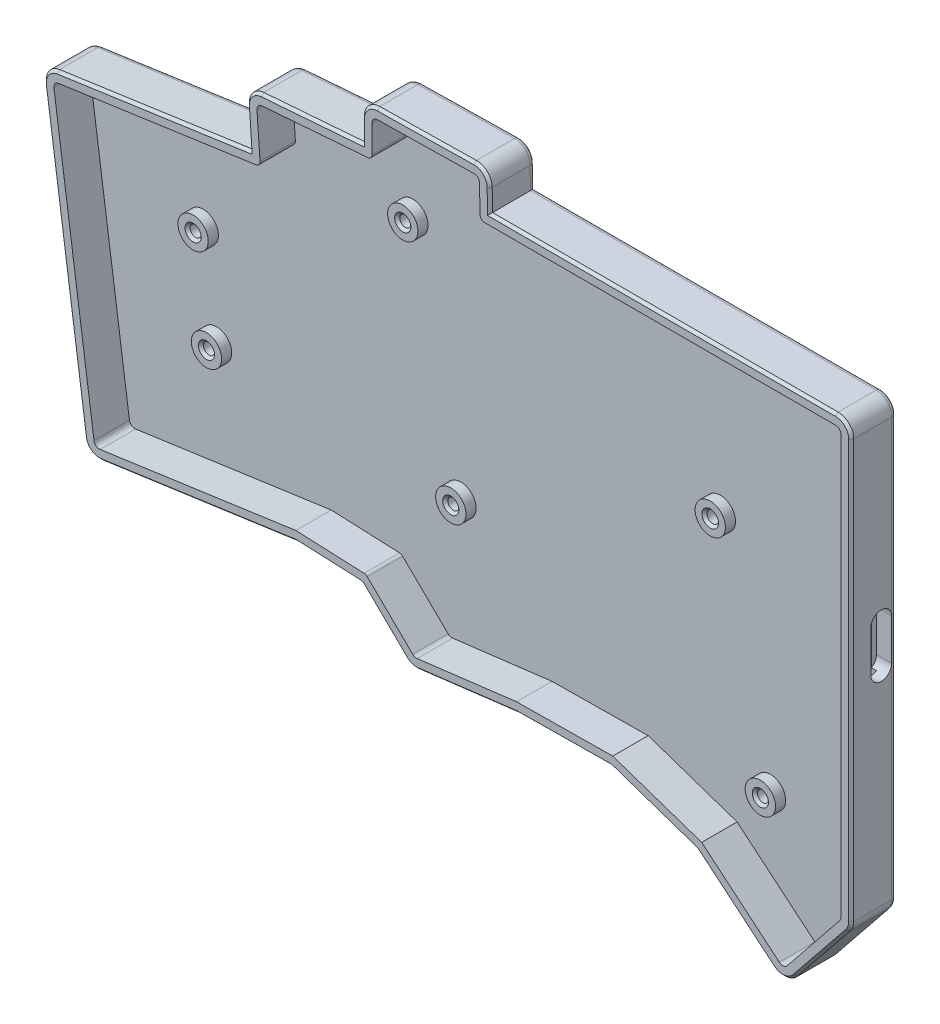
from build123d import *

# Parameters (mm, degrees)
BOSS_EXTRUDE1_DEPTH = 2
BOSS_EXTRUDE2_DEPTH = 9
SKETCH7_R           = 3
SKETCH7_R_2         = 1.100094
SKETCH7_R_3         = 1.100095
SKETCH7_R_4         = 1.14540164
SKETCH7_R_5         = 1.100094267
BOSS_EXTRUDE3_DEPTH = 4
CUT_EXTRUDE1_DEPTH  = 3
FILLET2_R           = 1
CHAMFER1_SIZE       = 0.5
CHAMFER2_SIZE       = 0.5


with BuildPart() as part:
    # Sketch3 → Boss-Extrude1 (new body)
    with BuildSketch(Plane.XY):
        with BuildLine():
            Line((60.855233133, 23.823211938), (47.949977192, 24.377676222))
            Line((47.949977192, 24.377676222), (9.438001399, 18.932389733))
            ThreePointArc((9.438001399, 18.932389733), (7.157815869, 19.520564151), (5.962231275, 21.549300871))
            Line((5.962231275, 21.549300871), (-1.970708405, 77.995680607))
            ThreePointArc((-1.970708405, 77.995680607), (-1.383464331, 80.271537635), (0.639738461, 81.467794829))
            Line((0.639738461, 81.467794829), (38.699898469, 86.902208152))
            Line((38.699898469, 86.902208152), (38.171393284, 94.460167157))
            ThreePointArc((38.171393284, 94.460167157), (38.910984807, 96.683773594), (41.002517903, 97.740613468))
            Line((41.002517903, 97.740613468), (60.921819416, 99.276682226))
            Line((60.921819416, 99.276682226), (60.921819416, 103.721902307))
            ThreePointArc((60.921819416, 103.721902307), (61.804499235, 105.878127499), (63.945786912, 106.796450874))
            Line((63.945786912, 106.796450874), (83.059551455, 107.113531682))
            ThreePointArc((83.059551455, 107.113531682), (85.251859467, 106.245869167), (86.185286941, 104.080744272))
            Line((86.185286941, 104.080744272), (86.24375422, 99.780452187))
            Line((86.24375422, 99.780452187), (154.596820419, 99.780452187))
            ThreePointArc((154.596820419, 99.780452187), (156.771169517, 98.879807301), (157.671814403, 96.705458202))
            Line((157.671814403, 96.705458202), (157.671814403, 14.057773112))
            ThreePointArc((157.671814403, 14.057773112), (157.497078938, 13.035997261), (156.992732263, 12.130352296))
            Line((156.992732263, 12.130352296), (146.547659954, -0.852593653))
            ThreePointArc((146.547659954, -0.852593653), (144.453525054, -1.98521487), (142.178510717, -1.283401812))
            Line((142.178510717, -1.283401812), (127.110775499, 11.324099062))
            Line((127.110775499, 11.324099062), (110.204782414, 17.079131321))
            Line((110.204782414, 17.079131321), (91.635796855, 16.870620568))
            Line((91.635796855, 16.870620568), (72.085555936, 14.46343429))
            ThreePointArc((72.085555936, 14.46343429), (70.725838171, 14.602041008), (69.560483965, 15.316179508))
            Line((69.560483965, 15.316179508), (60.855233133, 23.823211938))
        make_face()
    extrude(amount=BOSS_EXTRUDE1_DEPTH)

    # Sketch4 → Boss-Extrude2 (add)
    with BuildSketch(Plane.XY):
        with BuildLine():
            Line((47.949977192, 24.377676222), (60.855233133, 23.823211938))
            Line((60.855233133, 23.823211938), (69.560483965, 15.316179508))
            ThreePointArc((69.560483965, 15.316179508), (70.725838171, 14.602041008), (72.085555936, 14.46343429))
            Line((72.085555936, 14.46343429), (91.635796855, 16.870620568))
            Line((91.635796855, 16.870620568), (110.204782414, 17.079131321))
            Line((110.204782414, 17.079131321), (127.110775499, 11.324099062))
            Line((127.110775499, 11.324099062), (142.178510717, -1.283401812))
            ThreePointArc((142.178510717, -1.283401812), (144.453525054, -1.98521487), (146.547659954, -0.852593653))
            Line((146.547659954, -0.852593653), (156.992732263, 12.130352296))
            ThreePointArc((156.992732263, 12.130352296), (157.497078938, 13.035997261), (157.671814403, 14.057773112))
            Line((157.671814403, 14.057773112), (157.671814403, 96.705458202))
            ThreePointArc((157.671814403, 96.705458202), (156.771169517, 98.879807301), (154.596820419, 99.780452187))
            Line((154.596820419, 99.780452187), (86.24375422, 99.780452187))
            Line((86.24375422, 99.780452187), (86.185286941, 104.080744272))
            ThreePointArc((86.185286941, 104.080744272), (85.251859467, 106.245869167), (83.059551455, 107.113531682))
            Line((83.059551455, 107.113531682), (63.945786912, 106.796450874))
            ThreePointArc((63.945786912, 106.796450874), (61.804499235, 105.878127499), (60.921819416, 103.721902307))
            Line((60.921819416, 103.721902307), (60.921819416, 99.276682226))
            Line((60.921819416, 99.276682226), (41.002517903, 97.740613468))
            ThreePointArc((41.002517903, 97.740613468), (38.910984807, 96.683773594), (38.171393284, 94.460167157))
            Line((38.171393284, 94.460167157), (38.699898469, 86.902208152))
            Line((38.699898469, 86.902208152), (0.639738461, 81.467794829))
            ThreePointArc((0.639738461, 81.467794829), (-1.383464331, 80.271537635), (-1.970708405, 77.995680607))
            Line((-1.970708405, 77.995680607), (5.962231275, 21.549300871))
            ThreePointArc((5.962231275, 21.549300871), (7.157815869, 19.520564151), (9.438001399, 18.932389733))
            Line((9.438001399, 18.932389733), (47.949977192, 24.377676222))
        make_face()
        with BuildLine():
            ThreePointArc((84.258355662, 98.692914663), (84.533669024, 98.04695842), (85.183308419, 97.780452187))
            Line((85.183308419, 97.780452187), (154.596820419, 97.780452187))
            ThreePointArc((154.596820419, 97.780452187), (155.356955955, 97.465593738), (155.671814403, 96.705458202))
            Line((155.671814403, 96.705458202), (155.671814403, 14.057773112))
            ThreePointArc((155.671814403, 14.057773112), (155.610734868, 13.70060696), (155.434438315, 13.38403486))
            Line((155.434438315, 13.38403486), (144.989366006, 0.401088911))
            ThreePointArc((144.989366006, 0.401088911), (144.257272174, 0.005133041), (143.461944249, 0.250481615))
            Line((143.461944249, 0.250481615), (128.108249423, 13.097251096))
            Line((128.108249423, 13.097251096), (110.524936275, 19.082852408))
            Line((110.524936275, 19.082852408), (91.501949272, 18.869243682))
            Line((91.501949272, 18.869243682), (71.841145237, 16.448443965))
            ThreePointArc((71.841145237, 16.448443965), (71.365754809, 16.496904248), (70.958318613, 16.74658445))
            Line((70.958318613, 16.74658445), (61.958856362, 25.54112911))
            ThreePointArc((61.958856362, 25.54112911), (61.679828995, 25.728441638), (61.352295386, 25.803701118))
            Line((61.352295386, 25.803701118), (47.852081394, 26.383727313))
            Line((47.852081394, 26.383727313), (9.158002316, 20.91269287))
            ThreePointArc((9.158002316, 20.91269287), (8.360780393, 21.118336461), (7.942767807, 21.827644264))
            Line((7.942767807, 21.827644264), (0.009828128, 78.274024))
            ThreePointArc((0.009828128, 78.274024), (0.215128769, 79.069664055), (0.922440855, 79.487875801))
            Line((0.922440855, 79.487875801), (39.972806225, 85.063675424))
            ThreePointArc((39.972806225, 85.063675424), (40.561555536, 85.398058084), (40.76480024, 86.043913413))
            Line((40.76480024, 86.043913413), (40.166521363, 94.599680421))
            ThreePointArc((40.166521363, 94.599680421), (40.425084652, 95.377059525), (41.156290542, 95.746533736))
            Line((41.156290542, 95.746533736), (62.067941403, 97.359127107))
            ThreePointArc((62.067941403, 97.359127107), (62.675544492, 97.652931317), (62.921819416, 98.281303094))
            Line((62.921819416, 98.281303094), (62.921819416, 103.721902307))
            ThreePointArc((62.921819416, 103.721902307), (63.230393236, 104.475691655), (63.978960617, 104.796726017))
            Line((63.978960617, 104.796726017), (83.09272516, 105.113806824))
            ThreePointArc((83.09272516, 105.113806824), (83.859148665, 104.810474928), (84.185471769, 104.053554549))
            Line((84.185471769, 104.053554549), (84.258355662, 98.692914663))
        make_face(mode=Mode.SUBTRACT)
    extrude(amount=BOSS_EXTRUDE2_DEPTH)

    # Sketch7 → Boss-Extrude3 (add)
    # profile 1 of 6: a face of its own
    with BuildSketch(Plane.XY):
        with Locations((25.178343626, 43.435558637)):
            Circle(SKETCH7_R)
        with Locations((25.178343626, 43.435558637)):
            Circle(SKETCH7_R_2, mode=Mode.SUBTRACT)
    # profile 2 of 6: a face of its own
    with BuildSketch(Plane.XY):
        with Locations((22.534055897, 62.250653675)):
            Circle(SKETCH7_R)
        with Locations((22.534055897, 62.250653675)):
            Circle(SKETCH7_R_2, mode=Mode.SUBTRACT)
    # profile 3 of 6: a face of its own
    with BuildSketch(Plane.XY):
        with Locations((63.99681822, 84.705447078)):
            Circle(SKETCH7_R)
        with Locations((63.99681822, 84.705447078)):
            Circle(SKETCH7_R_3, mode=Mode.SUBTRACT)
    # profile 4 of 6: a face of its own
    with BuildSketch(Plane.XY):
        with Locations((73.496822591, 41.005447941)):
            Circle(SKETCH7_R)
        with Locations((73.496822591, 41.005447941)):
            Circle(SKETCH7_R_3, mode=Mode.SUBTRACT)
    # profile 5 of 6: a face of its own
    with BuildSketch(Plane.XY):
        with Locations((124.796820928, 64.405450202)):
            Circle(SKETCH7_R)
        with Locations((124.796820928, 64.405450202)):
            Circle(SKETCH7_R_4, mode=Mode.SUBTRACT)
    # profile 6 of 6: a face of its own
    with BuildSketch(Plane.XY):
        with Locations((134.70931431, 21.546419059)):
            Circle(SKETCH7_R)
        with Locations((134.70931431, 21.546419059)):
            Circle(SKETCH7_R_5, mode=Mode.SUBTRACT)
    extrude(amount=BOSS_EXTRUDE3_DEPTH)

    # Sketch8 → Cut-Extrude1 (cut)
    with BuildSketch(Plane(origin=(157.671814403, 0, 0), x_dir=(0, 0, -1), z_dir=(1, 0, 0))):
        with BuildLine():
            Line((-1, 62.669458202), (-1, 54.541458202))
            ThreePointArc((-1, 54.541458202), (-3.061576359, 52.479881843), (-5.123152718, 54.541458202))
            Line((-5.123152718, 54.541458202), (-5.123152718, 62.669458202))
            ThreePointArc((-5.123152718, 62.669458202), (-3.061576359, 64.731034561), (-1, 62.669458202))
        make_face()
    extrude(amount=-CUT_EXTRUDE1_DEPTH, mode=Mode.SUBTRACT)

    # Fillet2
    fillet2_edges = [part.edges().sort_by_distance(p)[0] for p in [
        (65.207858549, 19.569695723, 0),
        (54.402605163, 24.10044408, 0),
        (28.693989296, 21.655032978, 0),
        (7.157815869, 19.520564151, 0),
        (1.995761435, 49.772490739, 0),
        (-1.383464331, 80.271537635, 0),
        (19.669818465, 84.18500149, 0),
        (38.435645877, 90.681187654, 0),
        (38.910984807, 96.683773594, 0),
        (50.962168659, 98.508647847, 0),
        (60.921819416, 101.499292266, 0),
        (61.804499235, 105.878127499, 0),
        (73.502669184, 106.954991278, 0),
        (85.251859467, 106.245869167, 0),
        (86.21452058, 101.930598229, 0),
        (120.420287319, 99.780452187, 0),
        (156.771169517, 98.879807301, 0),
        (157.671814403, 55.381615657, 0),
        (157.497078938, 13.035997261, 0),
        (151.770196108, 5.638879321, 0),
        (144.453525054, -1.98521487, 0),
        (134.644643108, 5.020348625, 0),
        (118.657778957, 14.201615191, 0),
        (100.920289635, 16.974875944, 0),
        (81.860676395, 15.667027429, 0),
        (70.725838171, 14.602041008, 0),
    ]]
    fillet(fillet2_edges, radius=FILLET2_R - 0.0001)  # a hair under: the kernel refuses the full size

    # Chamfer1
    chamfer1_edges = [part.edges().sort_by_distance(p)[0] for p in [
        (70.725838171, 14.602041008, 9),
        (81.860676395, 15.667027429, 9),
        (100.920289635, 16.974875944, 9),
        (118.657778957, 14.201615191, 9),
        (134.644643108, 5.020348625, 9),
        (144.453525054, -1.98521487, 9),
        (151.770196108, 5.638879321, 9),
        (157.497078938, 13.035997261, 9),
        (157.671814403, 55.381615657, 9),
        (156.771169517, 98.879807301, 9),
        (120.420287319, 99.780452187, 9),
        (86.21452058, 101.930598229, 9),
        (85.251859467, 106.245869167, 9),
        (73.502669184, 106.954991278, 9),
        (61.804499235, 105.878127499, 9),
        (60.921819416, 101.499292266, 9),
        (50.962168659, 98.508647847, 9),
        (38.910984807, 96.683773594, 9),
        (38.435645877, 90.681187654, 9),
        (19.669818465, 84.18500149, 9),
        (-1.383464331, 80.271537635, 9),
        (1.995761435, 49.772490739, 9),
        (7.157815869, 19.520564151, 9),
        (28.693989296, 21.655032978, 9),
        (54.402605163, 24.10044408, 9),
        (65.207858549, 19.569695723, 9),
    ]]
    chamfer(chamfer1_edges, length=CHAMFER1_SIZE)

    # Chamfer2
    chamfer2_edges = [part.edges().sort_by_distance(p)[0] for p in [
        (133.609220043, 21.546419059, 4),
        (123.651419288, 64.405450202, 4),
        (72.396727591, 41.005447941, 4),
        (62.89672322, 84.705447078, 4),
        (21.433961897, 62.250653675, 4),
        (24.078249626, 43.435558637, 4),
    ]]
    chamfer(chamfer2_edges, length=CHAMFER2_SIZE)


solid = part.part
